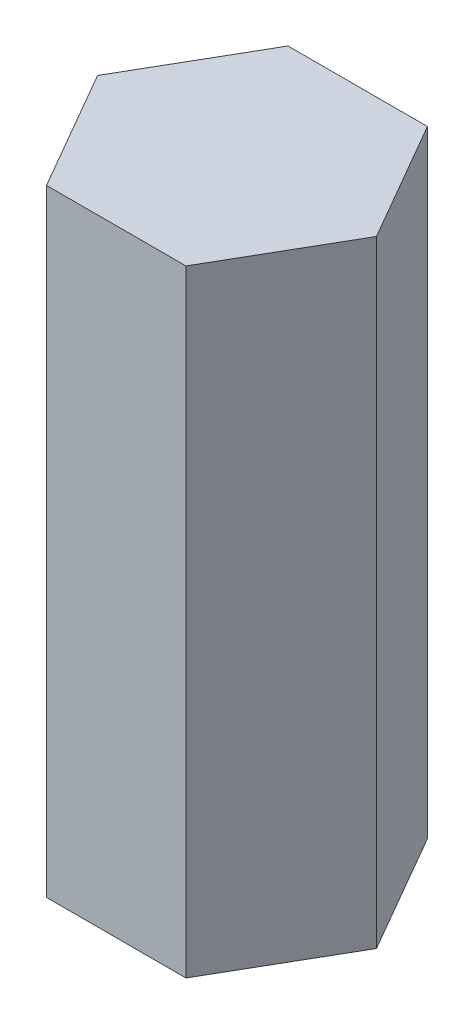
from build123d import *

# Parameters (mm, degrees)
BOSS_EXTRUDE1_DEPTH = 12


with BuildPart() as part:
    # Sketch1 → Boss-Extrude1 (new body)
    with BuildSketch(Plane(origin=(0, 0, 0), x_dir=(1, 0, 0), z_dir=(0, 1, 0))):
        Polygon((2.713546265, 0), (1.356773133, 2.35), (-1.356773133, 2.35), (-2.713546265, 0), (-1.356773133, -2.35), (1.356773133, -2.35), align=None)
    extrude(amount=BOSS_EXTRUDE1_DEPTH)


solid = part.part
